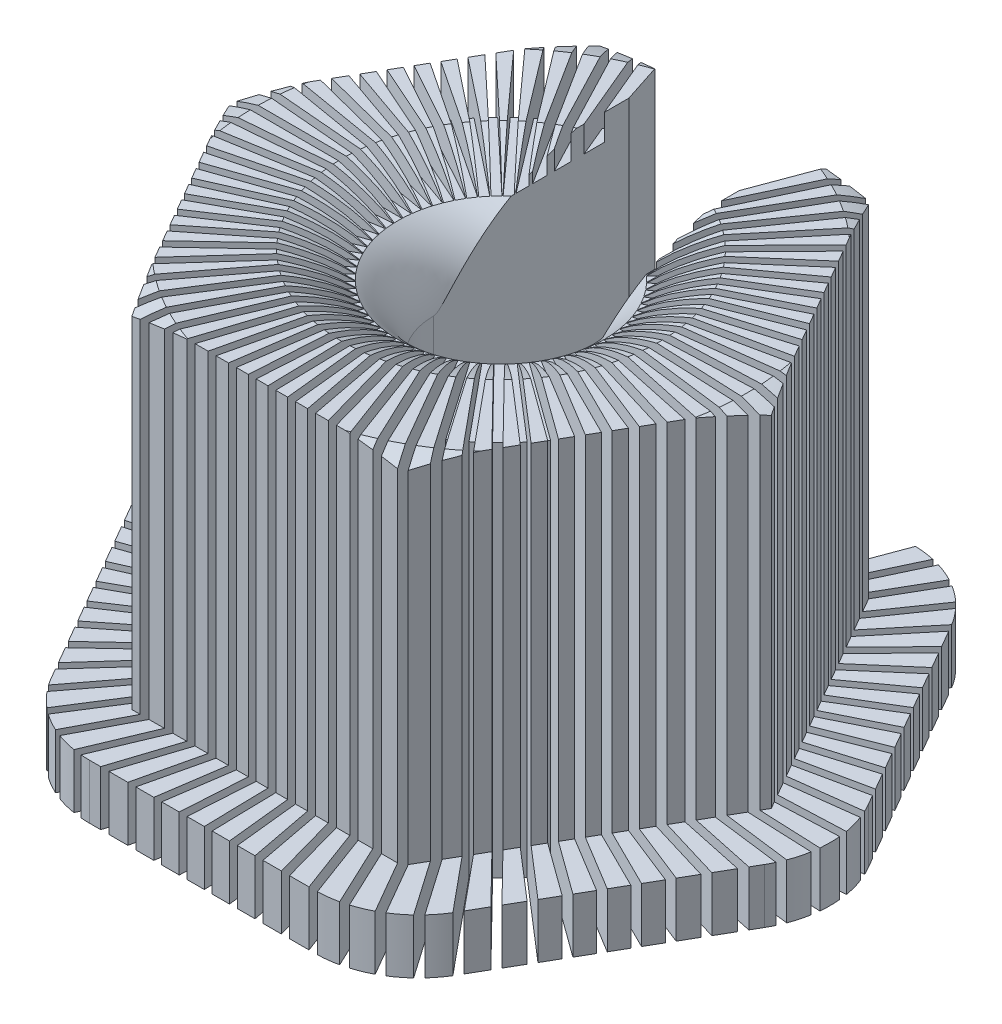
from build123d import *

# Parameters (mm, degrees)
BOSS_EXTRUDE2_DEPTH = 77.5
SKETCH6_R           = 13
CUT_EXTRUDE1_DEPTH  = 77.5
CUT_EXTRUDE2_DEPTH  = 0.75
CIRPATTERN1_COUNT   = 75
SKETCH9_OUTSIDE_W   = 166.142
SKETCH9_OUTSIDE_H   = 154.554
CUT_EXTRUDE3_DEPTH  = 67
SKETCH11_W          = 26
SKETCH11_H          = 62.142692489
CUT_EXTRUDE6_DEPTH  = 116.410358453


with BuildPart() as part:
    # Sketch1 → Boss-Extrude2 (new body)
    with BuildSketch(Plane(origin=(0, 0, 0), x_dir=(1, 0, 0), z_dir=(0, 1, 0))):
        with BuildLine():
            Line((60.621778265, 10), (38.97114317, 47.5))
            ThreePointArc((38.97114317, 47.5), (31.650635095, 54.820508076), (21.650635095, 57.5))
            Line((21.650635095, 57.5), (-21.650635095, 57.5))
            ThreePointArc((-21.650635095, 57.5), (-31.650635095, 54.820508076), (-38.97114317, 47.5))
            Line((-38.97114317, 47.5), (-60.621778265, 10))
            ThreePointArc((-60.621778265, 10), (-63.301270189, 0), (-60.621778265, -10))
            Line((-60.621778265, -10), (-38.97114317, -47.5))
            ThreePointArc((-38.97114317, -47.5), (-31.650635095, -54.820508076), (-21.650635095, -57.5))
            Line((-21.650635095, -57.5), (21.650635095, -57.5))
            ThreePointArc((21.650635095, -57.5), (31.650635095, -54.820508076), (38.97114317, -47.5))
            Line((38.97114317, -47.5), (60.621778265, -10))
            ThreePointArc((60.621778265, -10), (63.301270189, 0), (60.621778265, 10))
        make_face()
    extrude(amount=BOSS_EXTRUDE2_DEPTH)

    # Sketch6 → Cut-Extrude1 (cut)
    with BuildSketch(Plane(origin=(0, 77.5, 0), x_dir=(1, 0, 0), z_dir=(0, 1, 0))):
        with Locations(Location((0, 0, 0), (0, 0, 270))):
            Circle(SKETCH6_R)
    extrude(amount=-CUT_EXTRUDE1_DEPTH, mode=Mode.SUBTRACT)

    # Sketch7 → Cut-Revolve1 (revolve, cut)
    with BuildSketch(Plane.XY, mode=Mode.PRIVATE) as cut_revolve1_sk:
        with BuildLine():
            Line((13, 77.5), (13, 60))
            add(Edge.make_bspline(
                [(13, 60), (14.00368376, 72.891944156), (30.5, 77.5)],
                knots=[0, 0, 0, 1, 1, 1], degree=2))
            Line((30.5, 77.5), (13, 77.5))
        make_face()
        with BuildLine():
            Line((64.942286341, 77.5), (47.442286341, 77.5))
            add(Edge.make_bspline(
                [(64.942286341, 60), (63.93860258, 72.891944156), (47.442286341, 77.5)],
                knots=[0, 0, 0, 1, 1, 1], degree=2))
            Line((64.942286341, 60), (64.942286341, 77.5))
        make_face()
    revolve(cut_revolve1_sk.sketch.rotate(Axis((0, 77.5, 0), (0, -1, 0)), 90), axis=Axis((0, 77.5, 0), (0, -1, 0)), mode=Mode.SUBTRACT)

    # Sketch8 → Cut-Extrude2 (cut, symmetric)
    with BuildSketch(Plane.XY):
        Polygon((-63.301270189, 77.5), (-63.301270189, 0), (-38.301270189, 0), (-38.301270189, 5), (-38.301270189, 72.5), (-13.301270189, 72.5), (-13.301270189, 77.5), align=None)
    cut_extrude2 = extrude(amount=CUT_EXTRUDE2_DEPTH, both=True, mode=Mode.SUBTRACT)

    # CirPattern1: Cut-Extrude2 ×75 about axis
    cirpattern1_axis = Axis((0, 0, 0), (0, 1, 0))
    for i in range(1, CIRPATTERN1_COUNT):
        add(cut_extrude2.rotate(cirpattern1_axis, i * 360 / CIRPATTERN1_COUNT), mode=Mode.SUBTRACT)

    # Sketch9 outside → Cut-Extrude3 (cut)
    with BuildSketch(Plane(origin=(0, 77.5, 0), x_dir=(1, 0, 0), z_dir=(0, 1, 0))):
        with Locations((0.007, 0)):
            Rectangle(SKETCH9_OUTSIDE_W, SKETCH9_OUTSIDE_H)
        Polygon((51.961524227, 0), (25.980762114, 45), (-25.980762114, 45), (-51.961524227, 0), (-25.980762114, -45), (25.980762114, -45), align=None, mode=Mode.SUBTRACT)
    extrude(amount=-CUT_EXTRUDE3_DEPTH, mode=Mode.SUBTRACT)

    # Sketch11 → Cut-Extrude6 (cut, through all)
    with BuildSketch(Plane.XZ):
        with Locations((0, -31.071346245)):
            Rectangle(SKETCH11_W, SKETCH11_H)
    extrude(amount=-CUT_EXTRUDE6_DEPTH, mode=Mode.SUBTRACT)


with BuildPart() as body_2:
    # of the pieces the cut leaves, the one that is kept (cut_extrude6_keep)
    add(part.part.solids().sort_by_distance((-21.650635095, 0, 57.5))[0])


solid = body_2.part
